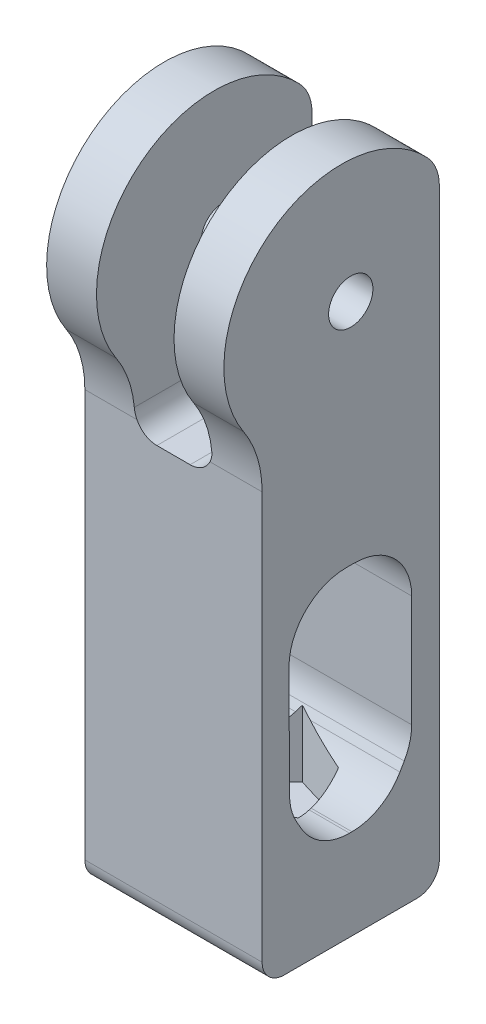
from build123d import *
from OCP.BRepFilletAPI import BRepFilletAPI_MakeChamfer

# Parameters (mm, degrees)
SKETCH9_R           = 2
BOSS_EXTRUDE3_DEPTH = 16
SKETCH10_R          = 2
CUT_EXTRUDE7_DEPTH  = 14
SKETCH11_W          = 7
SKETCH11_H          = 26.686138344
CUT_EXTRUDE8_DEPTH  = 28
FILLET1_R           = 2
CHAMFER1_SIZE       = 2.5
CHAMFER1_SIZE2      = 4.365846821
CHAMFER1_SIZE2_2    = 4.330127019
EXTRUDE1_DEPTH      = 3
EXTRUDE1_DEPTH_BACK = 3
FILLET2_R           = 2
FILLET3_R           = 5
FILLET4_R           = 5


with BuildPart() as part:
    # Sketch9 → Boss-Extrude3 (new body)
    with BuildSketch(Plane(origin=(0, 0, 0), x_dir=(0, 0, -1), z_dir=(1, 0, 0))):
        with BuildLine():
            Line((8, 5.053889445), (8, -49.642014822))
            Line((8, -49.642014822), (-8, -49.642014822))
            Line((-8, -49.642014822), (-8, -10.875806049))
            ThreePointArc((-8, -10.875806049), (-8.427714838, -7.982476346), (-9.674271354, -5.336650652))
            ThreePointArc((-9.674271354, -5.336650652), (-7.418447874, 8.870328147), (6.925281884, 7.78202542))
            ThreePointArc((6.925281884, 7.78202542), (7.721634556, 6.519985019), (8, 5.053889445))
        make_face()
        Circle(SKETCH9_R, mode=Mode.SUBTRACT)
        with BuildLine():
            Line((5.5, -41.5), (5.5, -25.762364524))
            ThreePointArc((5.5, -25.762364524), (3.987567872, -22.111030369), (0.336233717, -20.598598241))
            Line((0.336233717, -20.598598241), (-0.410415455, -20.598598241))
            ThreePointArc((-0.410415455, -20.598598241), (-4.070351606, -22.119652678), (-5.574124284, -25.786723302))
            Line((-5.574124284, -25.786723302), (-5.5, -41.5))
            Line((-5.5, -41.5), (5.5, -41.5))
        make_face(mode=Mode.SUBTRACT)
    extrude(amount=BOSS_EXTRUDE3_DEPTH)

    # Sketch10 → Cut-Extrude7 (cut)
    with BuildSketch(Plane.XZ.offset(49.642014822)):
        with Locations((8, 0)):
            Circle(SKETCH10_R)
    extrude(amount=-CUT_EXTRUDE7_DEPTH, mode=Mode.SUBTRACT)

    # Sketch11 → Cut-Extrude8 (cut)
    with BuildSketch(Plane(origin=(0, 16, 0), x_dir=(1, 0, 0), z_dir=(0, 1, 0))):
        with Locations((8, -2.737831409)):
            Rectangle(SKETCH11_W, SKETCH11_H)
    extrude(amount=-CUT_EXTRUDE8_DEPTH, mode=Mode.SUBTRACT)

    # Fillet1
    fillet1_edges = [part.edges().sort_by_distance(p)[0] for p in [
        (8, -49.642014822, -8),
        (8, -49.642014822, 8),
    ]]
    fillet(fillet1_edges, radius=FILLET1_R)

    # Chamfer1: one chamfer whose edges measure the first distance from different faces: ONE call of the kernel's chamfer builder (chamfer() names one face for all edges)
    chamfer1_edges_1 = [part.edges().sort_by_distance(p)[0] for p in [
        (8, -41.5, 5.5),
    ]]
    chamfer1_side_1 = [part.faces().sort_by_distance(p)[0] for p in [
        (8, -41.5, 5.305835122),
    ]]
    chamfer1_edges_2 = [part.edges().sort_by_distance(p)[0] for p in [
        (8, -41.5, -5.5),
    ]]
    chamfer1_side_2 = [part.faces().sort_by_distance(p)[0] for p in [
        (8, -41.5, 5.305835122),
    ]]
    chamfer1 = BRepFilletAPI_MakeChamfer(part.part.solid().wrapped)
    for e in chamfer1_edges_1:
        chamfer1.Add(CHAMFER1_SIZE, CHAMFER1_SIZE2, e.wrapped, chamfer1_side_1[0].wrapped)  # the first distance lies on this face
    for e in chamfer1_edges_2:
        chamfer1.Add(CHAMFER1_SIZE, CHAMFER1_SIZE2_2, e.wrapped, chamfer1_side_2[0].wrapped)  # the first distance lies on this face
    add(Compound.cast(chamfer1.Shape()), mode=Mode.REPLACE)

    # Sketch12 → Extrude1 (cut, two sides: drawn at the far end of the back side and taken through both)
    with BuildSketch(Plane(origin=(0, -41.5, 0), x_dir=(1, 0, 0), z_dir=(0, 1, 0)).offset(-EXTRUDE1_DEPTH_BACK)):
        Polygon((6.895214346, 4.750578313), (3.333485671, 1.418516714), (4.438271325, -3.332061599), (9.104785654, -4.750578313), (12.666514329, -1.418516714), (11.561728675, 3.332061599), align=None)
    extrude(amount=EXTRUDE1_DEPTH + EXTRUDE1_DEPTH_BACK, mode=Mode.SUBTRACT)

    # Fillet2
    fillet2_edges = [part.edges().sort_by_distance(p)[0] for p in [
        (4.5, -12, 0),
        (11.5, -12, 0),
    ]]
    fillet(fillet2_edges, radius=FILLET2_R)

    # Fillet3
    fillet3_edges = [part.edges().sort_by_distance(p)[0] for p in [
        (8, -37.169872981, -5.5),
        (8, -37.134201755, 5.520594792),
    ]]
    fillet(fillet3_edges, radius=FILLET3_R)

    # Fillet4
    fillet4_edges = [part.edges().sort_by_distance(p)[0] for p in [
        (2.511987469, -41.5, -3),
        (13.819476151, -41.5, -3),
        (2.180523849, -41.5, 3),
        (13.488012531, -41.5, 3),
    ]]
    fillet(fillet4_edges, radius=FILLET4_R)


solid = part.part
